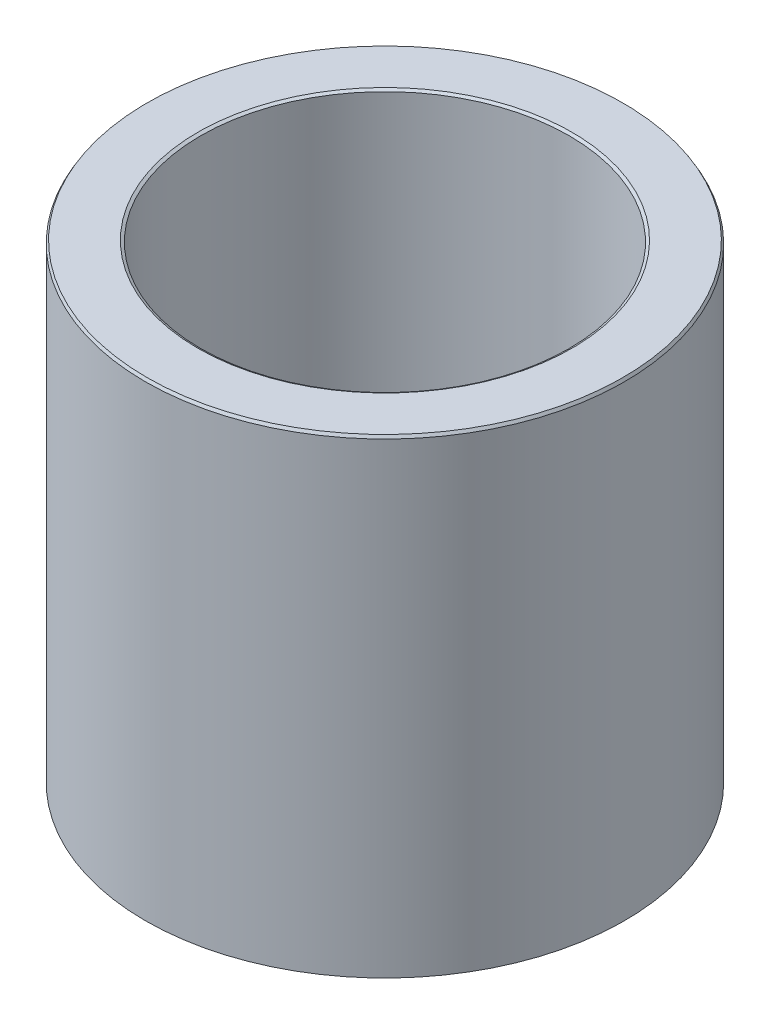
from build123d import *
from OCP.BRepFilletAPI import BRepFilletAPI_MakeChamfer

# Parameters (mm, degrees)
SKETCH1_R           = 55
BOSS_EXTRUDE1_DEPTH = 108.201678693
SKETCH2_R           = 42.314246458
CUT_EXTRUDE1_DEPTH  = 134.257657461
CHAMFER1_SIZE       = 0.647140554
CHAMFER1_SIZE2      = 0.373626773


with BuildPart() as part:
    # Sketch1 → Boss-Extrude1 (new body)
    with BuildSketch(Plane(origin=(0, 0, 0), x_dir=(1, 0, 0), z_dir=(0, 1, 0))):
        Circle(SKETCH1_R)
    extrude(amount=BOSS_EXTRUDE1_DEPTH)

    # Sketch2 → Cut-Extrude1 (cut, through all)
    with BuildSketch(Plane(origin=(0, 0, 0), x_dir=(1, 0, 0), z_dir=(0, 1, 0))):
        Circle(SKETCH2_R)
    extrude(amount=CUT_EXTRUDE1_DEPTH, mode=Mode.SUBTRACT)

    # Chamfer1: one chamfer whose edges measure the first distance from different faces: ONE call of the kernel's chamfer builder (chamfer() names one face for all edges)
    chamfer1_edges_1 = [part.edges().sort_by_distance(p)[0] for p in [
        (-42.314246458, 108.201678693, 0),
    ]]
    chamfer1_side_1 = [part.faces().sort_by_distance(p)[0] for p in [
        (-53.444365081, 108.201678693, 0),
    ]]
    chamfer1_edges_2 = [part.edges().sort_by_distance(p)[0] for p in [
        (-42.314246458, 0, 0),
    ]]
    chamfer1_side_2 = [part.faces().sort_by_distance(p)[0] for p in [
        (-42.314246458, 54.100839346, 0),
    ]]
    chamfer1_edges_3 = [part.edges().sort_by_distance(p)[0] for p in [
        (-55, 0, 0),
    ]]
    chamfer1_side_3 = [part.faces().sort_by_distance(p)[0] for p in [
        (-53.444365081, 0, 0),
    ]]
    chamfer1_edges_4 = [part.edges().sort_by_distance(p)[0] for p in [
        (-55, 108.201678693, 0),
    ]]
    chamfer1_side_4 = [part.faces().sort_by_distance(p)[0] for p in [
        (-55, 54.100839346, 0),
    ]]
    chamfer1 = BRepFilletAPI_MakeChamfer(part.part.solid().wrapped)
    for e in chamfer1_edges_1:
        chamfer1.Add(CHAMFER1_SIZE, CHAMFER1_SIZE2, e.wrapped, chamfer1_side_1[0].wrapped)  # the first distance lies on this face
    for e in chamfer1_edges_2:
        chamfer1.Add(CHAMFER1_SIZE, CHAMFER1_SIZE2, e.wrapped, chamfer1_side_2[0].wrapped)  # the first distance lies on this face
    for e in chamfer1_edges_3:
        chamfer1.Add(CHAMFER1_SIZE, CHAMFER1_SIZE2, e.wrapped, chamfer1_side_3[0].wrapped)  # the first distance lies on this face
    for e in chamfer1_edges_4:
        chamfer1.Add(CHAMFER1_SIZE, CHAMFER1_SIZE2, e.wrapped, chamfer1_side_4[0].wrapped)  # the first distance lies on this face
    add(Compound.cast(chamfer1.Shape()), mode=Mode.REPLACE)


solid = part.part
